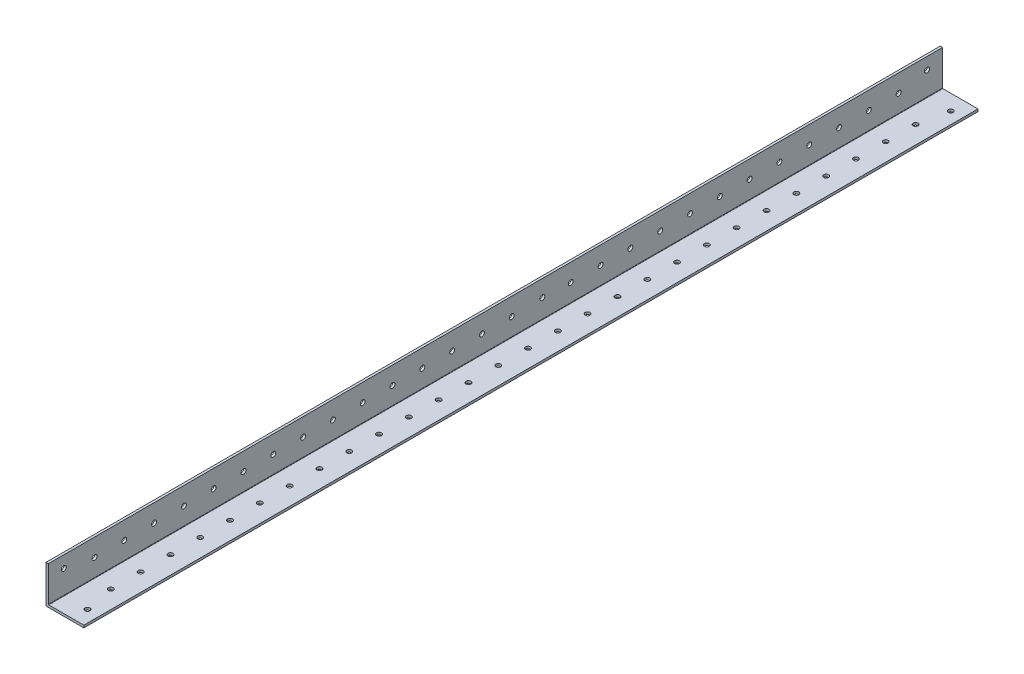
from build123d import *

# Parameters (mm, degrees)
BOSS_EXTRUDE1_DEPTH = 1219.2
FILLET1_R           = 0.254
SKETCH4_W           = 1838.4
SKETCH4_H           = 74.945320812
CUT_EXTRUDE1_DEPTH  = 60
SKETCH5_R           = 1.65
CUT_EXTRUDE2_DEPTH  = 10
SKETCH9_R           = 1.65
CUT_EXTRUDE6_DEPTH  = 60


with BuildPart() as part:
    # Sketch3 → Boss-Extrude1 (new, symmetric)
    with BuildSketch(Plane.XY):
        Polygon((1.5875, 25.4), (0, 25.4), (0, 0), (25.4, 0), (25.4, 1.5875), (1.5875, 1.5875), align=None)
    extrude(amount=BOSS_EXTRUDE1_DEPTH, both=True)

    # Fillet1
    fillet1_edges = [part.edges().sort_by_distance(p)[0] for p in [
        (1.5875, 1.5875, 0),
    ]]
    fillet(fillet1_edges, radius=FILLET1_R)

    # Sketch4 → Cut-Extrude1 (cut)
    with BuildSketch(Plane.ZY):
        with Locations((-300, 37.472660406)):
            Rectangle(SKETCH4_W, SKETCH4_H)
    extrude(amount=-CUT_EXTRUDE1_DEPTH, mode=Mode.SUBTRACT)

    # Sketch5 → Cut-Extrude2 (cut)
    with BuildSketch(Plane(origin=(0, 1.5875, 0), x_dir=(1, 0, 0), z_dir=(0, 1, 0))):
        with Locations((17.4625, -629.5759)):
            Circle(SKETCH5_R)
        with Locations((17.4625, -1208.8241)):
            Circle(SKETCH5_R)
        with Locations((13.49375, -1189.2)):
            Circle(SKETCH5_R)
        with Locations((13.49375, -1169.2)):
            Circle(SKETCH5_R)
        with Locations((13.49375, -1149.2)):
            Circle(SKETCH5_R)
        with Locations((13.49375, -1129.2)):
            Circle(SKETCH5_R)
        with Locations((13.49375, -1109.2)):
            Circle(SKETCH5_R)
        with Locations((13.49375, -1089.2)):
            Circle(SKETCH5_R)
        with Locations((13.49375, -1069.2)):
            Circle(SKETCH5_R)
        with Locations((13.49375, -1049.2)):
            Circle(SKETCH5_R)
        with Locations((13.49375, -1029.2)):
            Circle(SKETCH5_R)
        with Locations((13.49375, -1009.2)):
            Circle(SKETCH5_R)
        with Locations((13.49375, -989.2)):
            Circle(SKETCH5_R)
        with Locations((13.49375, -969.2)):
            Circle(SKETCH5_R)
        with Locations((13.49375, -949.2)):
            Circle(SKETCH5_R)
        with Locations((13.49375, -929.2)):
            Circle(SKETCH5_R)
        with Locations((13.49375, -909.2)):
            Circle(SKETCH5_R)
        with Locations((13.49375, -889.2)):
            Circle(SKETCH5_R)
        with Locations((13.49375, -869.2)):
            Circle(SKETCH5_R)
        with Locations((13.49375, -849.2)):
            Circle(SKETCH5_R)
        with Locations((13.49375, -829.2)):
            Circle(SKETCH5_R)
        with Locations((13.49375, -809.2)):
            Circle(SKETCH5_R)
        with Locations((13.49375, -789.2)):
            Circle(SKETCH5_R)
        with Locations((13.49375, -769.2)):
            Circle(SKETCH5_R)
        with Locations((13.49375, -749.2)):
            Circle(SKETCH5_R)
        with Locations((13.49375, -729.2)):
            Circle(SKETCH5_R)
        with Locations((13.49375, -709.2)):
            Circle(SKETCH5_R)
        with Locations((13.49375, -689.2)):
            Circle(SKETCH5_R)
        with Locations((13.49375, -669.2)):
            Circle(SKETCH5_R)
        with Locations((13.49375, -649.2)):
            Circle(SKETCH5_R)
    extrude(amount=-CUT_EXTRUDE2_DEPTH, mode=Mode.SUBTRACT)

    # Sketch9 → Cut-Extrude6 (cut)
    with BuildSketch(Plane(origin=(1.5875, 0, 0), x_dir=(0, 0, -1), z_dir=(1, 0, 0))):
        with Locations((-629.5759, 17.4625)):
            Circle(SKETCH9_R)
        with Locations((-648.634825, 13.49375)):
            Circle(SKETCH9_R)
        with Locations((-887.69375, 14.2875)):
            Circle(SKETCH9_R)
        with Locations((-1208.8241, 17.463)):
            Circle(SKETCH9_R)
        with Locations((-668.634825, 13.49375)):
            Circle(SKETCH9_R)
        with Locations((-688.634825, 13.49375)):
            Circle(SKETCH9_R)
        with Locations((-708.634825, 13.49375)):
            Circle(SKETCH9_R)
        with Locations((-728.634825, 13.49375)):
            Circle(SKETCH9_R)
        with Locations((-748.634825, 13.49375)):
            Circle(SKETCH9_R)
        with Locations((-768.634825, 13.49375)):
            Circle(SKETCH9_R)
        with Locations((-788.634825, 13.49375)):
            Circle(SKETCH9_R)
        with Locations((-808.634825, 13.49375)):
            Circle(SKETCH9_R)
        with Locations((-828.634825, 13.49375)):
            Circle(SKETCH9_R)
        with Locations((-848.634825, 13.49375)):
            Circle(SKETCH9_R)
        with Locations((-868.634825, 13.49375)):
            Circle(SKETCH9_R)
        with Locations((-908.258925, 13.49375)):
            Circle(SKETCH9_R)
        with Locations((-928.258925, 13.49375)):
            Circle(SKETCH9_R)
        with Locations((-948.258925, 13.49375)):
            Circle(SKETCH9_R)
        with Locations((-968.258925, 13.49375)):
            Circle(SKETCH9_R)
        with Locations((-988.258925, 13.49375)):
            Circle(SKETCH9_R)
        with Locations((-1008.258925, 13.49375)):
            Circle(SKETCH9_R)
        with Locations((-1028.258925, 13.49375)):
            Circle(SKETCH9_R)
        with Locations((-1048.258925, 13.49375)):
            Circle(SKETCH9_R)
        with Locations((-1068.258925, 13.49375)):
            Circle(SKETCH9_R)
        with Locations((-1088.258925, 13.49375)):
            Circle(SKETCH9_R)
        with Locations((-1108.258925, 13.49375)):
            Circle(SKETCH9_R)
        with Locations((-1128.258925, 13.49375)):
            Circle(SKETCH9_R)
        with Locations((-1148.258925, 13.49375)):
            Circle(SKETCH9_R)
        with Locations((-1168.258925, 13.49375)):
            Circle(SKETCH9_R)
        with Locations((-1188.258925, 13.49375)):
            Circle(SKETCH9_R)
    extrude(amount=-CUT_EXTRUDE6_DEPTH, mode=Mode.SUBTRACT)


solid = part.part
